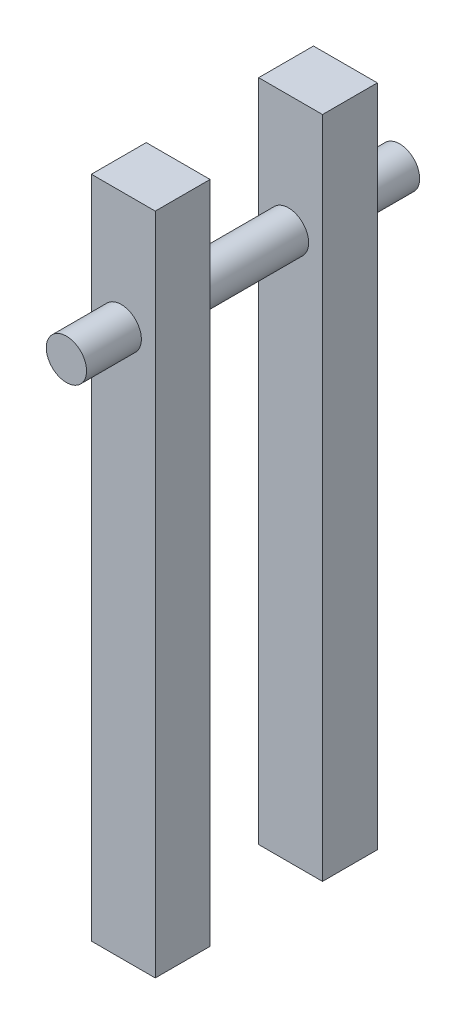
from build123d import *

# Parameters (mm, degrees)
SKETCH1_W                = 7.9
SKETCH1_H                = 95.7
BOSS_EXTRUDE1_DEPTH      = 9.2
SKETCH1_3_W              = 7.9
SKETCH1_3_H              = 95.7
BOSS_EXTRUDE2_DEPTH      = 9.2
BOSS_EXTRUDE3_DEPTH      = 32
BOSS_EXTRUDE3_DEPTH_BACK = 16
SKETCH2_R                = 2.9


with BuildPart() as part:
    # Sketch1 → Boss-Extrude1 (new body)
    with BuildSketch(Plane(origin=(0, 0, 0), x_dir=(0, 0, -1), z_dir=(1, 0, 0))):
        with Locations((-28.171698113, -0.670754717)):
            Rectangle(SKETCH1_W, SKETCH1_H)
    extrude(amount=BOSS_EXTRUDE1_DEPTH)

    # Sketch1<3> → Boss-Extrude2 (add)
    with BuildSketch(Plane(origin=(0, 0, 0), x_dir=(0, 0, -1), z_dir=(1, 0, 0))):
        with Locations((-28.171698113, -0.670754717)):
            Rectangle(SKETCH1_3_W, SKETCH1_3_H)
        with Locations((-4.071698113, -0.670754717)):
            Rectangle(SKETCH1_3_W, SKETCH1_3_H)
    extrude(amount=BOSS_EXTRUDE2_DEPTH)


with BuildPart() as boss_extrude2_piece_1:
    # of the separate pieces the step leaves, piece 1, a body of its own (boss_extrude2_pieces)
    add(part.part.solids().sort_by_distance((0, 47.179245283, 8.021698113))[0])



with BuildPart() as boss_extrude2_piece_2:
    # of the separate pieces the step leaves, piece 2, a body of its own (boss_extrude2_pieces)
    add(part.part.solids().sort_by_distance((0, 47.179245283, 32.121698113))[0])


with BuildPart() as boss_extrude2_piece_1_1:
    add(boss_extrude2_piece_1.part)

    add(boss_extrude2_piece_2.part)  # Boss-Extrude3 merges Boss-Extrude2 piece 2
    # Sketch2 → Boss-Extrude3 (add, two sides: drawn at the far end of the back side and taken through both)
    with BuildSketch(Plane.XY.offset(8.021698113).offset(-BOSS_EXTRUDE3_DEPTH_BACK)):
        with Locations((4.3, 30.179245283)):
            Circle(SKETCH2_R)
    extrude(amount=BOSS_EXTRUDE3_DEPTH + BOSS_EXTRUDE3_DEPTH_BACK)


solid = boss_extrude2_piece_1_1.part
